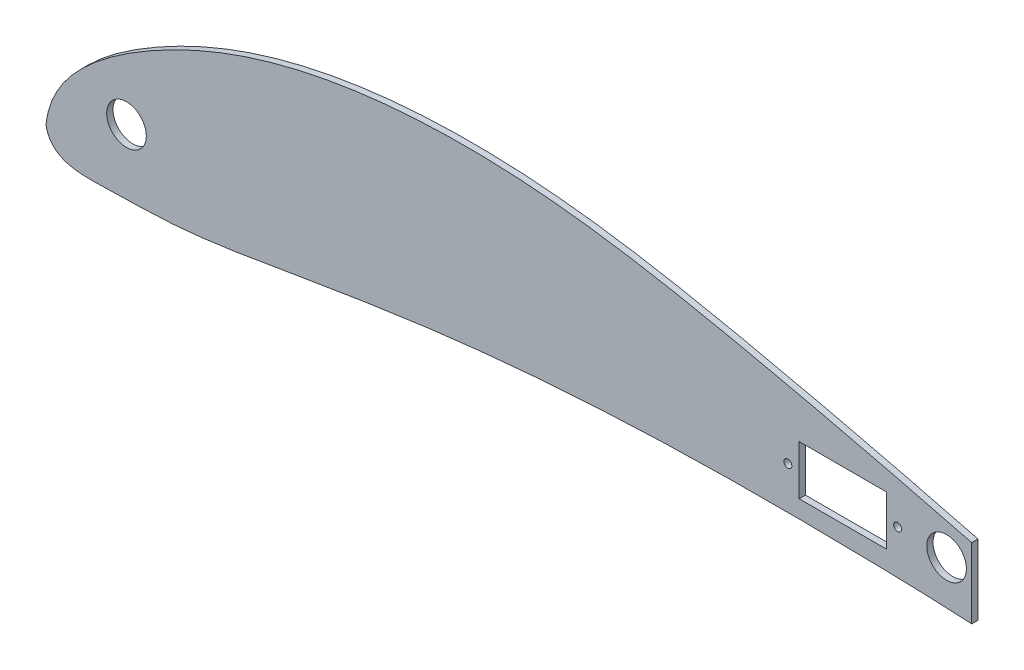
from build123d import *

# Parameters (mm, degrees)
BOSS_EXTRUDE1_DEPTH = 1.5875
SKETCH2_R           = 5
CUT_EXTRUDE1_DEPTH  = 316.731983488
SKETCH3_W           = 116.84
SKETCH3_H           = 50.8
CUT_EXTRUDE2_DEPTH  = 316.731983488
SKETCH4_R           = 1.00076
SKETCH4_W           = 22
SKETCH4_H           = 12.5
CUT_EXTRUDE3_DEPTH  = 239.581081252


with BuildPart() as part:
    # Sketch1 → Boss-Extrude1 (new body)
    with BuildSketch(Plane.XY):
        with BuildLine():
            add(Edge.make_bspline(
                [(0.000560351, 0.000130087), (0.810633127, 7.359196055), (8.649092025, 17.856605174), (26.286719818, 29.975176328), (52.111128271, 42.069215275), (89.597618475, 49.290763054), (131.400792109, 47.884831915), (173.256699242, 40.041104278), (217.961060472, 29.612974894), (256.952064401, 19.528920948), (290.35983767, 8.71099439), (301.273197721, 4.382828139), (314.816918223, -0.516206742), (309.846313895, 0.000130087)],
                knots=[0, 0, 0, 0, 0.060863618, 0.113688265, 0.188608742, 0.312908923, 0.448482434, 0.557612135, 0.691544113, 0.852438279, 0.92975597, 0.976058229, 1, 1, 1, 1], degree=3))
            add(Edge.make_bspline(
                [(309.846313895, 0.000130087), (303.956832565, 1.47095521), (293.989507544, 2.093987313), (276.26402299, 4.514356704), (260.846344817, 5.427413394), (235.858814759, 7.870306192), (205.101424636, 8.838080282), (157.718638092, 9.030650149), (110.497331172, 6.181495223), (66.506197185, -0.586669107), (36.454672816, -6.098499901), (15.316603331, -6.189065841), (1.230714189, -6.924076091), (0.000560351, 0.000130087)],
                knots=[0, 0, 0, 0, 0.057787081, 0.095274891, 0.171021118, 0.205339302, 0.335319146, 0.464904334, 0.658702312, 0.785511947, 0.893517288, 0.94309214, 1, 1, 1, 1], degree=3))
        make_face()
    extrude(amount=BOSS_EXTRUDE1_DEPTH)

    # Sketch2 → Cut-Extrude1 (cut, through all)
    with BuildSketch(Plane.XY.offset(1.5875)):
        with Locations((20.32, 10.16)):
            Circle(SKETCH2_R)
        with Locations((227.296313895, 19.050130087)):
            Circle(SKETCH2_R)
    extrude(amount=-CUT_EXTRUDE1_DEPTH, mode=Mode.SUBTRACT)

    # Sketch3 → Cut-Extrude2 (cut, through all)
    with BuildSketch(Plane.XY.offset(1.5875)):
        with Locations((292.066313895, 19.050130087)):
            Rectangle(SKETCH3_W, SKETCH3_H)
    extrude(amount=-CUT_EXTRUDE2_DEPTH, mode=Mode.SUBTRACT)

    # Sketch4 → Cut-Extrude3 (cut, through all)
    with BuildSketch(Plane.XY.offset(1.5875)):
        with Locations((214.949245332, 19.518092278)):
            Circle(SKETCH4_R)
        with Locations((187.249245332, 19.518092278)):
            Circle(SKETCH4_R)
        with Locations((201.099245332, 19.518092278)):
            Rectangle(SKETCH4_W, SKETCH4_H)
    extrude(amount=-CUT_EXTRUDE3_DEPTH, mode=Mode.SUBTRACT)


solid = part.part
